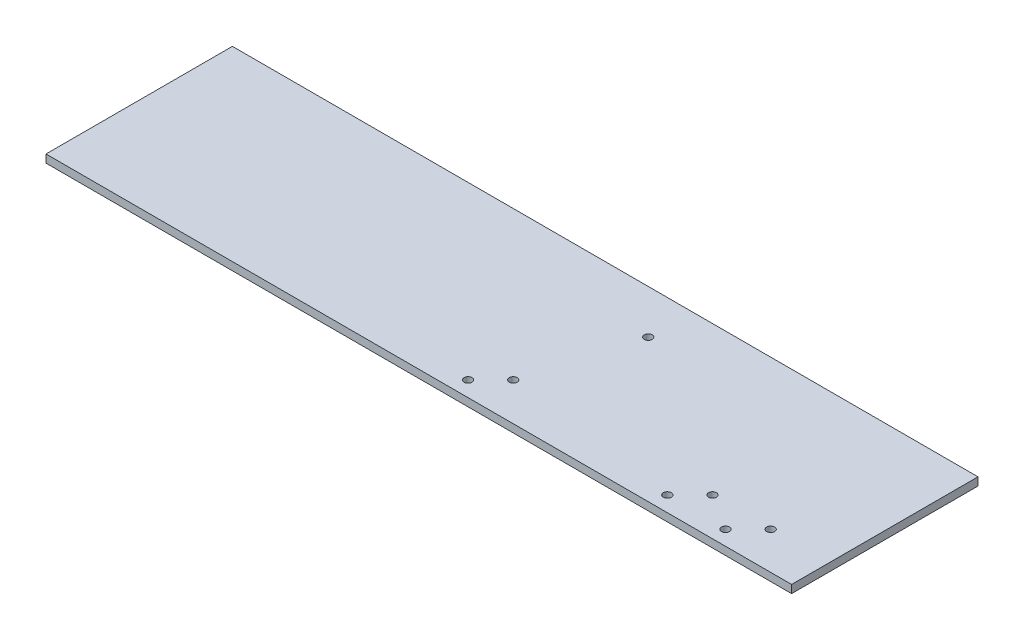
from build123d import *

# Parameters (mm, degrees)
SKETCH1_W           = 280
SKETCH1_H           = 70
SKETCH1_R           = 1.5
BOSS_EXTRUDE1_DEPTH = 3


with BuildPart() as part:
    # Sketch1 → Boss-Extrude1 (new body)
    with BuildSketch(Plane(origin=(0, 0, 0), x_dir=(1, 0, 0), z_dir=(0, 1, 0))):
        Rectangle(SKETCH1_W, SKETCH1_H)
        with Locations((87.571170369, -29.242640687)):
            Circle(SKETCH1_R, mode=Mode.SUBTRACT)
        with Locations((96.056451743, -20.757359313)):
            Circle(SKETCH1_R, mode=Mode.SUBTRACT)
        with Locations((109.651524032, -29.47828083)):
            Circle(SKETCH1_R, mode=Mode.SUBTRACT)
        with Locations((118.136805406, -20.992999456)):
            Circle(SKETCH1_R, mode=Mode.SUBTRACT)
        with Locations((32.64342059, 18.5)):
            Circle(SKETCH1_R, mode=Mode.SUBTRACT)
        with Locations((12.729398157, -29.242640687)):
            Circle(SKETCH1_R, mode=Mode.SUBTRACT)
        with Locations((21.214679531, -20.757359313)):
            Circle(SKETCH1_R, mode=Mode.SUBTRACT)
    extrude(amount=BOSS_EXTRUDE1_DEPTH)


solid = part.part
